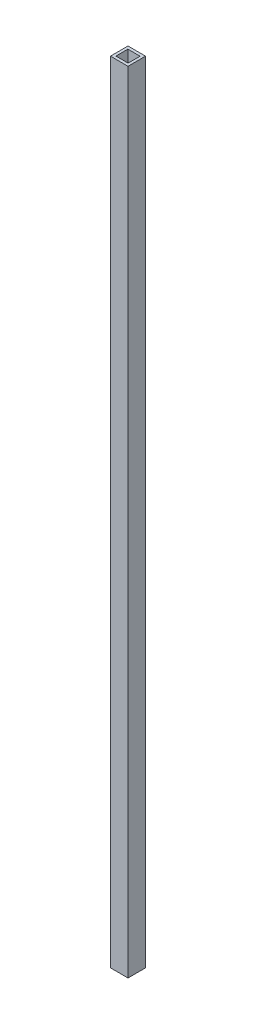
from build123d import *

# Parameters (mm, degrees)
SKETCH1_W           = 25.4
SKETCH1_H           = 25.4
BOSS_EXTRUDE1_DEPTH = 1143
SKETCH2_W           = 17.675538218
SKETCH2_H           = 17.34907709
CUT_EXTRUDE1_DEPTH  = 1143


with BuildPart() as part:
    # Sketch1 → Boss-Extrude1 (new body)
    with BuildSketch(Plane(origin=(0, 0, 0), x_dir=(1, 0, 0), z_dir=(0, 1, 0))):
        Rectangle(SKETCH1_W, SKETCH1_H)
    extrude(amount=BOSS_EXTRUDE1_DEPTH)

    # Sketch2 → Cut-Extrude1 (cut)
    with BuildSketch(Plane.XZ):
        Rectangle(SKETCH2_W, SKETCH2_H)
    extrude(amount=-CUT_EXTRUDE1_DEPTH, mode=Mode.SUBTRACT)


solid = part.part
